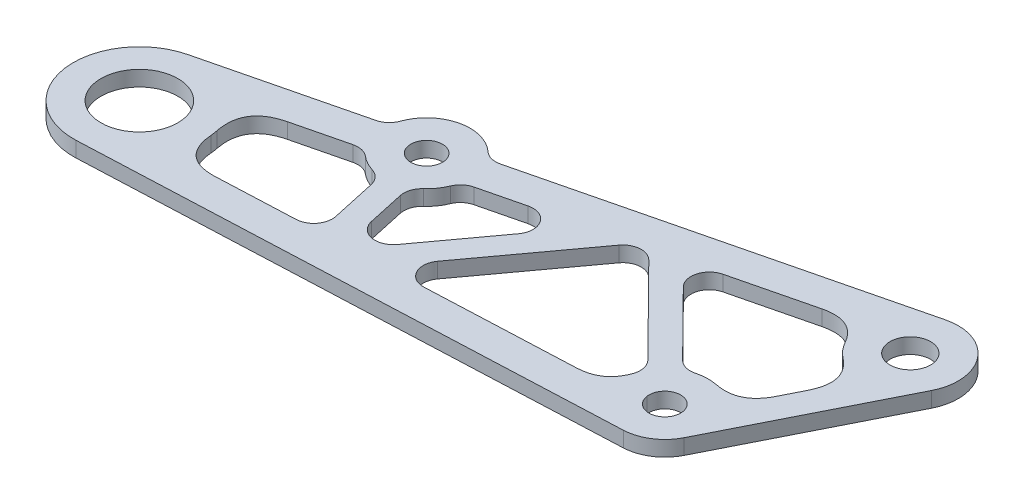
from build123d import *

# Parameters (mm, degrees)
SKETCH1_R           = 7.9375
SKETCH1_R_2         = 3.2639
SKETCH1_R_3         = 4.191
BOSS_EXTRUDE4_DEPTH = 3.175
FILLET2_R           = 3.81


with BuildPart() as part:
    # Sketch1 → Boss-Extrude4 (new body)
    with BuildSketch(Plane(origin=(0, 0, 0), x_dir=(1, 0, 0), z_dir=(0, 1, 0))):
        with BuildLine():
            ThreePointArc((133.726592386, 29.98785526), (132.627611185, 40.61059676), (122.521356715, 44.06226552))
            Line((122.521356715, 44.06226552), (46.442862481, 25.430137021))
            ThreePointArc((46.442862481, 25.430137021), (36.958837973, 28.991331503), (30.193743977, 21.450619984))
            Line((30.193743977, 21.450619984), (-3.247611444, 13.260609947))
            ThreePointArc((-3.247611444, 13.260609947), (-13.515826194, -1.926966151), (0.587616374, -13.639848359))
            Line((0.587616374, -13.639848359), (108.971460257, -8.970579339))
            ThreePointArc((108.971460257, -8.970579339), (113.459157615, -7.540771363), (116.60566957, -4.036025875))
            Line((116.60566957, -4.036025875), (133.726592386, 29.98785526))
        make_face()
        with Locations(Location((0, 0, 0), (0, 0, 270))):
            Circle(SKETCH1_R, mode=Mode.SUBTRACT)
        with BuildLine():
            Line((41.984168993, -4.864970405), (12.189591197, -6.148546389))
            ThreePointArc((12.189591197, -6.148546389), (13.515826194, 1.926966151), (9.985636063, 9.310092839))
            Line((9.985636063, 9.310092839), (32.042893317, 14.712061629))
            ThreePointArc((32.042893317, 14.712061629), (34.888474765, 12.337435423), (38.450716367, 11.314391845))
            Line((38.450716367, 11.314391845), (41.984168993, -4.864970405))
        make_face(mode=Mode.SUBTRACT)
        with BuildLine():
            Line((69.18664036, 23.808811963), (47.410466333, -5.902378846))
            Line((47.410466333, -5.902378846), (43.413738486, 12.398279038))
            ThreePointArc((43.413738486, 12.398279038), (46.36017499, 14.994407118), (47.916850432, 18.599699151))
            Line((47.916850432, 18.599699151), (69.18664036, 23.808811963))
        make_face(mode=Mode.SUBTRACT)
        with Locations(Location((108.585, 0, 0), (0, 0, 270))):
            Circle(SKETCH1_R_2, mode=Mode.SUBTRACT)
        with Locations(Location((39.094708942, 20.270167566, 0), (0, 0, 270))):
            Circle(SKETCH1_R_2, mode=Mode.SUBTRACT)
        with BuildLine():
            Line((99.924218758, -2.368863331), (54.876229285, -4.309569382))
            Line((54.876229285, -4.309569382), (78.030840873, 27.282347644))
            Line((78.030840873, 27.282347644), (100.723144875, 4.337266328))
            ThreePointArc((100.723144875, 4.337266328), (99.66914772, 1.062178575), (99.924218758, -2.368863331))
        make_face(mode=Mode.SUBTRACT)
        with BuildLine():
            Line((84.823475635, 27.638376771), (114.98908268, 35.026134276))
            ThreePointArc((114.98908268, 35.026134276), (117.570132445, 27.752761279), (124.58688197, 24.538885311))
            Line((124.58688197, 24.538885311), (115.260501822, 6.004858086))
            ThreePointArc((115.260501822, 6.004858086), (110.126982004, 8.845503757), (104.335087932, 7.90941797))
            Line((104.335087932, 7.90941797), (84.823475635, 27.638376771))
        make_face(mode=Mode.SUBTRACT)
        with Locations(Location((124.877763158, 34.440613651, 0), (0, 0, 270))):
            Circle(SKETCH1_R_3, mode=Mode.SUBTRACT)
    extrude(amount=-BOSS_EXTRUDE4_DEPTH)

    # Fillet1
    # a fillet whose section is not a circle: 7.62 mm, written as the material it adds along each edge
    with BuildSketch(Plane(origin=(115.260501822, 0, -6.004858086), x_dir=(-0.8680919950979666, 0, -0.4964033521712276), z_dir=(0, -1, 0))) as fillet1_piece_1:
        with BuildLine():
            Bezier((5.628236023, 0), (0.097286133, 1.825453133), (0.407253439, 7.641603586), weights=[1, 1, 1])
            Line((0.407253439, 7.641603586), (0, 0))
            ThreePointArc((0, 0), (2.814118011, 0.452389282), (5.628236023, 0))
        make_face()
    extrude(amount=3.175)
    with BuildSketch(Plane(origin=(124.58688197, 0, -24.538885311), x_dir=(-0.9406523774093201, 0, -0.3393716323946274), z_dir=(0, -1, 0))) as fillet1_piece_2:
        with BuildLine():
            Bezier((6.173495259, 0), (0.234745196, -1.947499202), (0.982676409, -8.152505596), weights=[1, 1, 1])
            Line((0.982676409, -8.152505596), (0, 0))
            ThreePointArc((0, 0), (3.08674763, -0.493198872), (6.173495259, 0))
        make_face()
    extrude(amount=3.175)
    with BuildSketch(Plane(origin=(114.98908268, 0, -35.026134276), x_dir=(-0.9712953632492297, 0, 0.23787668513443497), z_dir=(0, -1, 0))) as fillet1_piece_3:
        with BuildLine():
            Bezier((7.418766675, 0), (1.629858857, 0), (0.077760385, -5.576956522), weights=[1, 1, 1])
            ThreePointArc((0.077760385, -5.576956522), (0.439489428, -2.782892503), (0, 0))
            Line((0, 0), (7.418766675, 0))
        make_face()
    extrude(amount=3.175)
    with BuildSketch(Plane(origin=(9.985636063, 0, -9.310092839), x_dir=(0.4554657293432797, 0, 0.8902533175415829), z_dir=(0, -1, 0))) as fillet1_piece_4:
        with BuildLine():
            Bezier((7.480452048, 0), (0.473095274, -1.996096811), (2.153427849, -9.085803001), weights=[1, 1, 1])
            Line((2.153427849, -9.085803001), (0, 0))
            ThreePointArc((0, 0), (3.740226024, -0.522326142), (7.480452048, 0))
        make_face()
    extrude(amount=3.175)
    with BuildSketch(Plane(origin=(99.924218758, 0, 2.368863331), x_dir=(0.01787605144618897, 0, -0.9998402106260246), z_dir=(0, -1, 0))) as fillet1_piece_5:
        with BuildLine():
            Bezier((5.046610766, 0), (-0.091794663, -1.504663887), (-0.417829547, -6.848906118), weights=[1, 1, 1])
            Line((-0.417829547, -6.848906118), (0, 0))
            ThreePointArc((0, 0), (2.523305383, -0.361848581), (5.046610766, 0))
        make_face()
    extrude(amount=3.175)
    with BuildSketch(Plane(origin=(12.189591197, 0, 6.148546389), x_dir=(0.9990733095506228, 0, -0.043040935672514394), z_dir=(0, -1, 0))) as fillet1_piece_6:
        with BuildLine():
            Bezier((9.337508644, 0), (2.051395042, 0), (1.725151149, -7.27880597), weights=[1, 1, 1])
            ThreePointArc((1.725151149, -7.27880597), (1.370821683, -3.518943481), (0, 0))
            Line((0, 0), (9.337508644, 0))
        make_face()
    extrude(amount=3.175)

    # Fillet2
    fillet2_edges = [part.edges().sort_by_distance(p)[0] for p in [
        (104.335087932, -1.5875, -7.90941797),
        (100.723144875, -1.5875, -4.337266328),
        (84.823475635, -1.5875, -27.638376771),
        (69.18664036, -1.5875, -23.808811963),
        (41.984168993, -1.5875, 4.864970405),
        (32.042893317, -1.5875, -14.712061629),
        (47.916850432, -1.5875, -18.599699151),
        (38.450716367, -1.5875, -11.314391845),
        (43.413738486, -1.5875, -12.398279038),
        (54.876229285, -1.5875, 4.309569382),
        (47.410466333, -1.5875, 5.902378846),
        (78.030840873, -1.5875, -27.282347644),
        (30.193743977, -1.5875, -21.450619984),
        (46.442862481, -1.5875, -25.430137021),
    ]]
    fillet(fillet2_edges, radius=FILLET2_R)


solid = part.part
